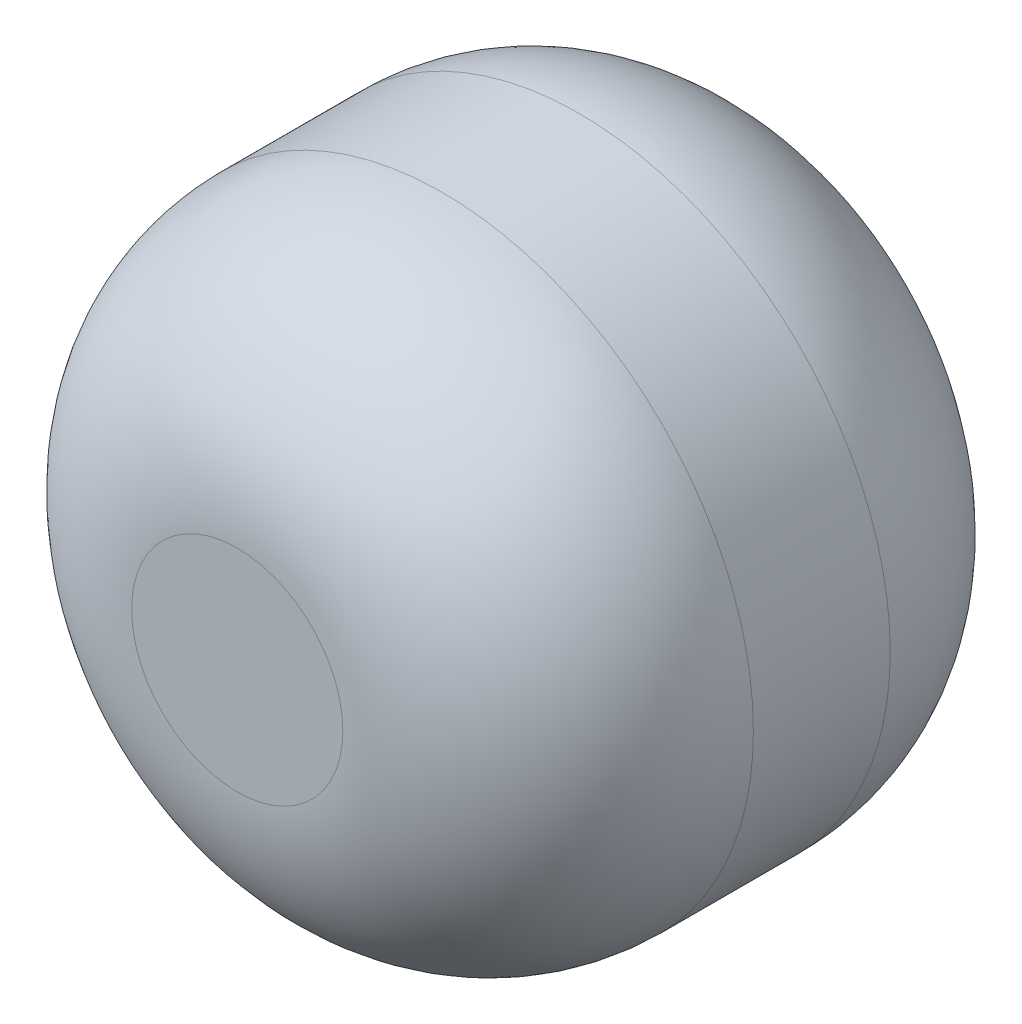
from build123d import *

# Parameters (mm, degrees)
SKIZZE1_R                       = 45.438470597
AUFSATZ_LINEAR_AUSTRAGEN1_DEPTH = 80
VERRUNDUNG1_R                   = 30


with BuildPart() as part:
    # Skizze1 → Aufsatz-Linear austragen1 (new body)
    with BuildSketch(Plane.XY):
        with Locations((17.004176026, 109.694558522)):
            Circle(SKIZZE1_R)
    extrude(amount=AUFSATZ_LINEAR_AUSTRAGEN1_DEPTH)

    # Verrundung1
    verrundung1_edges = [part.edges().sort_by_distance(p)[0] for p in [
        (-28.434294572, 109.694558522, 0),
        (-28.434294572, 109.694558522, 80),
    ]]
    fillet(verrundung1_edges, radius=VERRUNDUNG1_R)


solid = part.part
